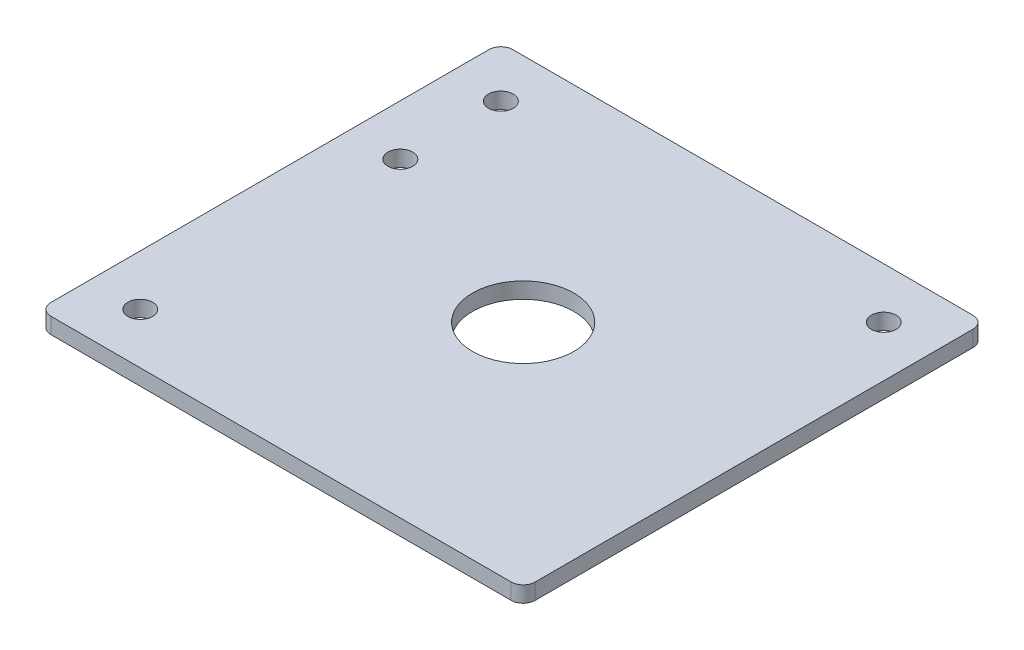
from build123d import *

# Parameters (mm, degrees)
SKETCH1_W           = 121.4
SKETCH1_H           = 115.8
SKETCH1_R           = 12.7
SKETCH1_R_2         = 3.1
BOSS_EXTRUDE1_DEPTH = 4
FILLET1_R           = 3


with BuildPart() as part:
    # Sketch1 → Boss-Extrude1 (new body)
    with BuildSketch(Plane(origin=(0, 0, 0), x_dir=(1, 0, 0), z_dir=(0, 1, 0))):
        with Locations((61.417527055, -57.9)):
            Rectangle(SKETCH1_W, SKETCH1_H)
        with Locations((64.217527055, -57.9)):
            Circle(SKETCH1_R, mode=Mode.SUBTRACT)
        with Locations((13.417527055, -12.7)):
            Circle(SKETCH1_R_2, mode=Mode.SUBTRACT)
        with Locations((109.417527055, -12.7)):
            Circle(SKETCH1_R_2, mode=Mode.SUBTRACT)
        with Locations((13.417527055, -103.1)):
            Circle(SKETCH1_R_2, mode=Mode.SUBTRACT)
        with Locations((13.417527055, -37.9)):
            Circle(SKETCH1_R_2, mode=Mode.SUBTRACT)
    extrude(amount=BOSS_EXTRUDE1_DEPTH)

    # Fillet1
    fillet1_edges = [part.edges().sort_by_distance(p)[0] for p in [
        (122.117527055, 2, 0),
        (122.117527055, 2, 115.8),
        (0.717527055, 2, 115.8),
        (0.717527055, 2, 0),
    ]]
    fillet(fillet1_edges, radius=FILLET1_R)


solid = part.part
